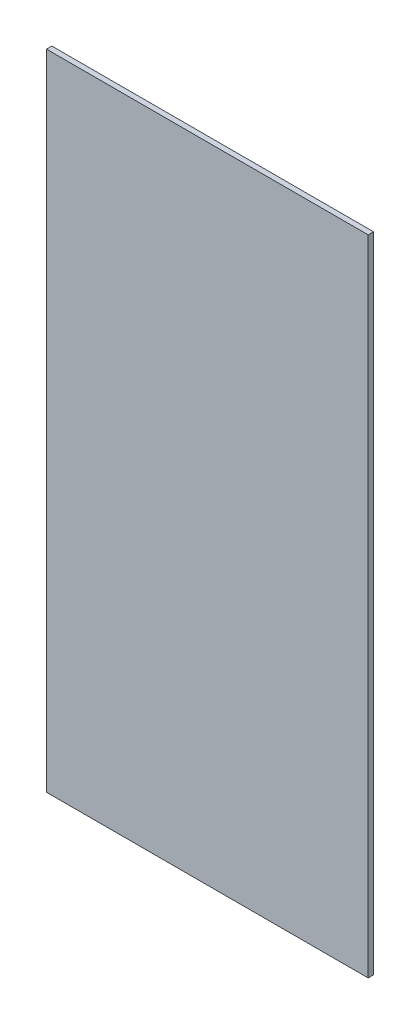
from build123d import *

# Parameters (mm, degrees)
SKETCH2_W           = 190.5
SKETCH2_H           = 381
BOSS_EXTRUDE1_DEPTH = 3.175


with BuildPart() as part:
    # Sketch2 → Boss-Extrude1 (new body)
    with BuildSketch(Plane.XY):
        with Locations((95.25, 190.5)):
            Rectangle(SKETCH2_W, SKETCH2_H)
    extrude(amount=BOSS_EXTRUDE1_DEPTH)


solid = part.part
